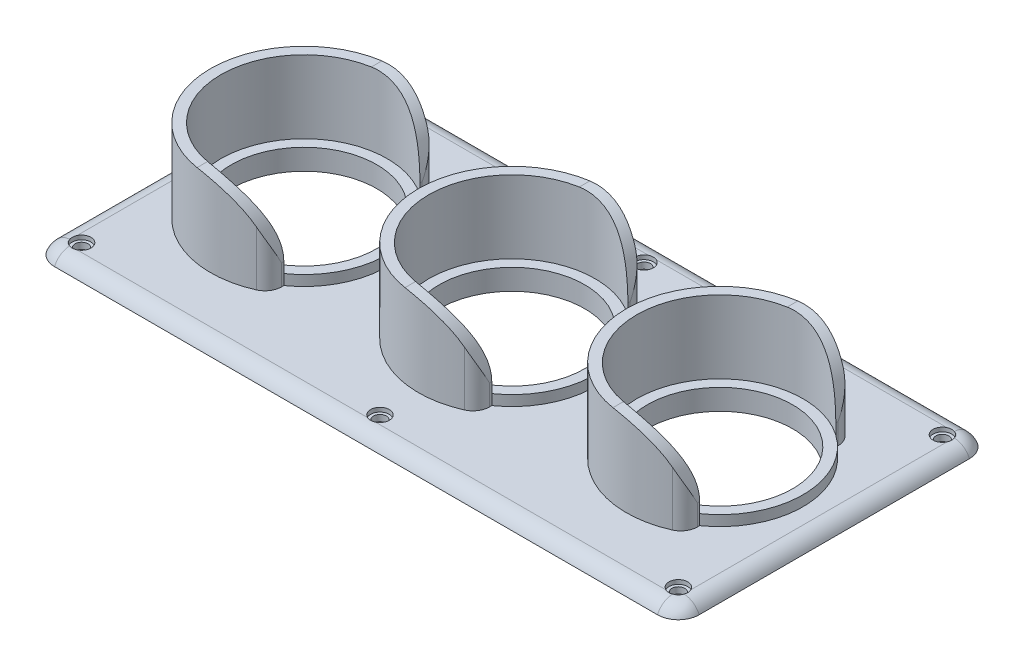
from build123d import *

# Parameters (mm, degrees)
CROQUIS3_W              = 310
CROQUIS3_H              = 150
SALIENTE_EXTRUIR1_DEPTH = 5
CROQUIS5_R              = 40
CROQUIS5_R_2            = 35
SALIENTE_EXTRUIR2_DEPTH = 5
SALIENTE_EXTRUIR5_DEPTH = 40
REDONDEO3_START         = -46
REDONDEO3_DEPTH         = 13.273863656
REDONDEO4_START         = -44.452221542
REDONDEO4_DEPTH         = 90.452221542
CORTAR_EXTRUIR1_START   = -40
CROQUIS7_R              = 35
CORTAR_EXTRUIR1_DEPTH   = 40
MATRIZL1_COUNT          = 3
MATRIZL1_PITCH          = 100
SKETCH1_R               = 3.1
CUT_EXTRUDE1_DEPTH      = 177.776695319
SKETCH2_R               = 4.5
CUT_EXTRUDE2_DEPTH      = 2
FILLET1_R               = 10
FILLET2_R               = 8


with BuildPart() as part:
    # Croquis3 → Saliente-Extruir1 (new body)
    with BuildSketch(Plane(origin=(0, 0, 0), x_dir=(1, 0, 0), z_dir=(0, 1, 0))):
        Rectangle(CROQUIS3_W, CROQUIS3_H)
    extrude(amount=SALIENTE_EXTRUIR1_DEPTH)

    # Croquis5 → Saliente-Extruir2 (add)
    # profile 1 of 3: a face of its own
    with BuildSketch(Plane(origin=(0, 5, 0), x_dir=(1, 0, 0), z_dir=(0, 1, 0))):
        with Locations(Location((-100, 0, 0), (0, 0, 270))):
            Circle(CROQUIS5_R)
        with Locations(Location((-100, 0, 0), (0, 0, 270))):
            Circle(CROQUIS5_R_2, mode=Mode.SUBTRACT)
    # profile 2 of 3: a face of its own
    with BuildSketch(Plane(origin=(0, 5, 0), x_dir=(1, 0, 0), z_dir=(0, 1, 0))):
        with Locations(Location((0, 0, 0), (0, 0, 270))):
            Circle(CROQUIS5_R)
        with Locations(Location((0, 0, 0), (0, 0, 270))):
            Circle(CROQUIS5_R_2, mode=Mode.SUBTRACT)
    # profile 3 of 3: a face of its own
    with BuildSketch(Plane(origin=(0, 5, 0), x_dir=(1, 0, 0), z_dir=(0, 1, 0))):
        with Locations(Location((100, 0, 0), (0, 0, 270))):
            Circle(CROQUIS5_R)
        with Locations(Location((100, 0, 0), (0, 0, 270))):
            Circle(CROQUIS5_R_2, mode=Mode.SUBTRACT)
    extrude(amount=SALIENTE_EXTRUIR2_DEPTH)

    # Croquis6 → Saliente-Extruir5 (add)
    with BuildSketch(Plane(origin=(0, 5, 0), x_dir=(1, 0, 0), z_dir=(0, 1, 0))):
        with BuildLine():
            Line((-77, 33.823069051), (-77, 32.726136344))
            ThreePointArc((-77, 32.726136344), (-140, 0), (-77, -32.726136344))
            Line((-77, -32.726136344), (-77, -33.823069051))
            ThreePointArc((-77, -33.823069051), (-78.293810846, -38.185067105), (-81.756756757, -41.136165062))
            ThreePointArc((-81.756756757, -41.136165062), (-145, 0), (-81.756756757, 41.136165062))
            ThreePointArc((-81.756756757, 41.136165062), (-78.293810846, 38.185067105), (-77, 33.823069051))
        make_face()
    saliente_extruir5 = extrude(amount=SALIENTE_EXTRUIR5_DEPTH)

    # Redondeo3: read off the stored shape, not the designer's step
    # Redondeo3 outline → Redondeo3 (cut)
    with BuildSketch(Plane.XY.offset(REDONDEO3_START)):
        with BuildLine():
            ThreePointArc((-107.000000862, 45), (-85.786796869, 36.21320374), (-77, 15))
            Line((-77, 15), (-77, 45))
            Line((-77, 45), (-107.000000862, 45))
        make_face()
    redondeo3 = extrude(amount=REDONDEO3_DEPTH, mode=Mode.SUBTRACT)

    # Redondeo4: read off the stored shape, not the designer's step
    # Redondeo4 outline → Redondeo4 (cut)
    with BuildSketch(Plane.XY.offset(REDONDEO4_START)):
        with BuildLine():
            ThreePointArc((-107.000000862, 45), (-85.786796869, 36.21320374), (-77, 15))
            Line((-77, 15), (-77, 45))
            Line((-77, 45), (-107.000000862, 45))
        make_face()
    redondeo4 = extrude(amount=REDONDEO4_DEPTH, mode=Mode.SUBTRACT)

    # Croquis7 → Cortar-Extruir1 (cut)
    with BuildSketch(Plane(origin=(0, 5, 0), x_dir=(1, 0, 0), z_dir=(0, 1, 0)).offset(CORTAR_EXTRUIR1_START)):
        with Locations(Location((-100, 0, 0), (0, 0, 270))):
            Circle(CROQUIS7_R)
    cortar_extruir1 = extrude(amount=CORTAR_EXTRUIR1_DEPTH, mode=Mode.SUBTRACT)

    # MatrizL1: Saliente-Extruir5, Redondeo3, Redondeo4, Cortar-Extruir1 ×3
    with Locations(*[(i * MATRIZL1_PITCH, 0, 0) for i in range(1, MATRIZL1_COUNT)]):
        add(saliente_extruir5)
        add(redondeo3, mode=Mode.SUBTRACT)
        add(redondeo4, mode=Mode.SUBTRACT)
        add(cortar_extruir1, mode=Mode.SUBTRACT)

    # Sketch1 → Cut-Extrude1 (cut, through all)
    with BuildSketch(Plane(origin=(0, 5, 0), x_dir=(1, 0, 0), z_dir=(0, 1, 0))):
        with Locations(Location((-143.5, 63.5, 0), (0, 0, 270))):
            Circle(SKETCH1_R)
        with Locations(Location((0, 63.5, 0), (0, 0, 270))):
            Circle(SKETCH1_R)
        with Locations(Location((143.5, 63.5, 0), (0, 0, 270))):
            Circle(SKETCH1_R)
        with Locations(Location((143.5, -63.5, 0), (0, 0, 90))):
            Circle(SKETCH1_R)
        with Locations(Location((0, -63.5, 0), (0, 0, 90))):
            Circle(SKETCH1_R)
        with Locations(Location((-143.5, -63.5, 0), (0, 0, 90))):
            Circle(SKETCH1_R)
    extrude(amount=-CUT_EXTRUDE1_DEPTH, mode=Mode.SUBTRACT)

    # Sketch2 → Cut-Extrude2 (cut)
    with BuildSketch(Plane(origin=(0, 5, 0), x_dir=(1, 0, 0), z_dir=(0, 1, 0))):
        with Locations(Location((-143.5, 63.5, 0), (0, 0, 270))):
            Circle(SKETCH2_R)
        with Locations(Location((0, 63.5, 0), (0, 0, 270))):
            Circle(SKETCH2_R)
        with Locations(Location((143.5, 63.5, 0), (0, 0, 270))):
            Circle(SKETCH2_R)
        with Locations(Location((0, -63.5, 0), (0, 0, 270))):
            Circle(SKETCH2_R)
        with Locations(Location((143.5, -63.5, 0), (0, 0, 270))):
            Circle(SKETCH2_R)
        with Locations(Location((-143.5, -63.5, 0), (0, 0, 270))):
            Circle(SKETCH2_R)
    extrude(amount=-CUT_EXTRUDE2_DEPTH, mode=Mode.SUBTRACT)

    # Fillet1
    fillet1_edges = [part.edges().sort_by_distance(p)[0] for p in [
        (-155, 2.5, -75),
        (155, 2.5, -75),
        (155, 2.5, 75),
        (-155, 2.5, 75),
    ]]
    fillet(fillet1_edges, radius=FILLET1_R)

    # Fillet2
    # the kernel refuses this fillet: 8 mm, written as the material it takes off along each edge
    with BuildSketch(Plane(origin=(-145, 5, -65), x_dir=(-1, 0, 0), z_dir=(0, 0, 1))) as fillet2_piece_1:
        with BuildLine():
            CenterArc((2.583801513, 8), FILLET2_R, 270, 67.975687163)
            Line((10, 5), (10, 0))
            Line((10, 0), (2.583801513, 0))
        make_face()
    revolve(axis=Axis((-145, 5, -65), (0, -1, 0)), revolution_arc=90, mode=Mode.SUBTRACT)
    with BuildSketch(Plane(origin=(-145, 5, -75), x_dir=(0, 0, 1), z_dir=(1, 0, 0))) as fillet2_piece_2:
        with BuildLine():
            CenterArc((7.416198487, 8), FILLET2_R, 202.024312837, 67.975687163)
            Line((0, 5), (0, 0))
            Line((0, 0), (7.416198487, 0))
        make_face()
    extrude(amount=290, mode=Mode.SUBTRACT)
    with BuildSketch(Plane(origin=(145, 5, -65), x_dir=(1, 0, 0), z_dir=(0, 0, 1))) as fillet2_piece_3:
        with BuildLine():
            CenterArc((2.583801513, -8), FILLET2_R, 22.024312837, 67.975687163)
            Line((10, -5), (10, 0))
            Line((10, 0), (2.583801513, 0))
        make_face()
    revolve(axis=Axis((145, 5, -65), (0, 1, 0)), revolution_arc=90, mode=Mode.SUBTRACT)
    with BuildSketch(Plane(origin=(155, 5, -65), x_dir=(-1, 0, 0), z_dir=(0, 0, 1)), Plane(origin=(-155, 5, 65), x_dir=(1, 0, 0), z_dir=(0, 0, -1))) as fillet2_piece_4:
        with BuildLine():
            CenterArc((7.416198487, 8), FILLET2_R, 202.024312837, 67.975687163)
            Line((0, 5), (0, 0))
            Line((0, 0), (7.416198487, 0))
        make_face()
    extrude(amount=130, mode=Mode.SUBTRACT)
    with BuildSketch(Plane(origin=(145, 5, 65), x_dir=(0, 0, 1), z_dir=(-1, 0, 0))) as fillet2_piece_5:
        with BuildLine():
            CenterArc((2.583801513, -8), FILLET2_R, 22.024312837, 67.975687163)
            Line((2.583801513, 0), (10, 0))
            Line((10, 0), (10, -5))
        make_face()
    revolve(axis=Axis((145, 5, 65), (0, 1, 0)), revolution_arc=90, mode=Mode.SUBTRACT)
    with BuildSketch(Plane(origin=(145, 5, 75), x_dir=(0, -1, 0), z_dir=(-1, 0, 0))) as fillet2_piece_6:
        with BuildLine():
            CenterArc((8, -7.416198487), FILLET2_R, 112.024312837, 67.975687163)
            Line((0, -7.416198487), (0, 0))
            Line((0, 0), (5, 0))
        make_face()
    extrude(amount=290, mode=Mode.SUBTRACT)
    with BuildSketch(Plane(origin=(-145, 5, 65), x_dir=(0, 0, 1), z_dir=(1, 0, 0))) as fillet2_piece_7:
        with BuildLine():
            CenterArc((2.583801513, 8), FILLET2_R, 270, 67.975687163)
            Line((2.583801513, 0), (10, 0))
            Line((10, 0), (10, 5))
        make_face()
    revolve(axis=Axis((-145, 5, 65), (0, -1, 0)), revolution_arc=90, mode=Mode.SUBTRACT)


solid = part.part
